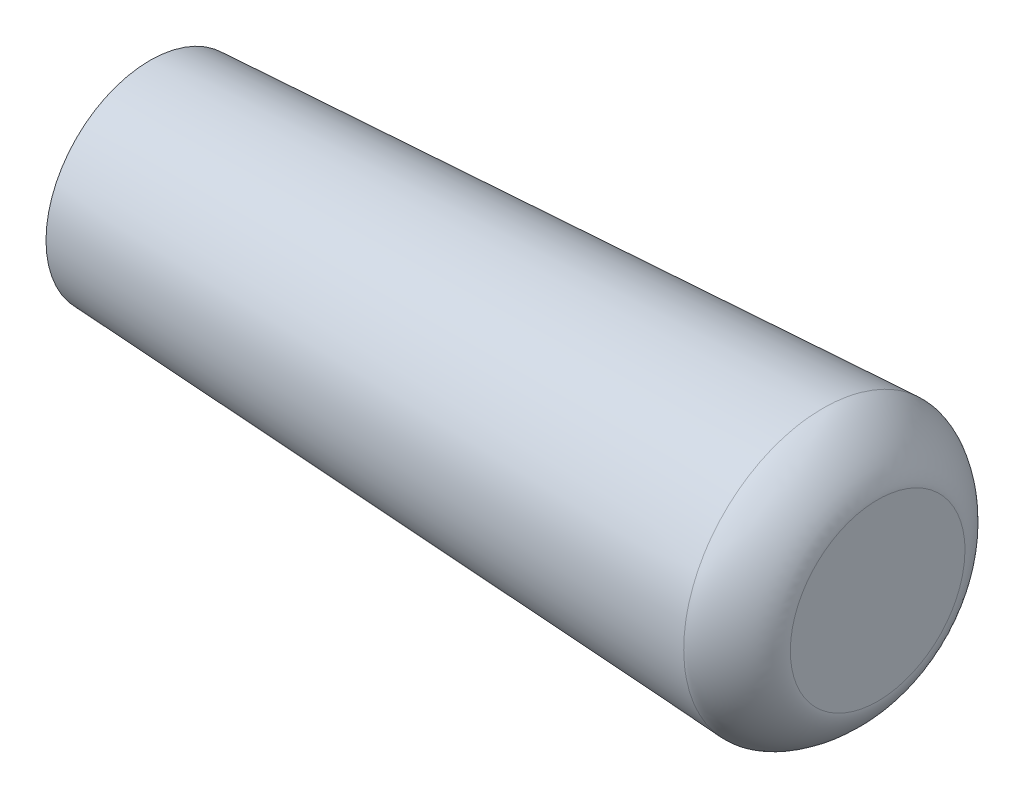
from build123d import *

# Parameters (mm, degrees)
SZKIC1_R                    = 10
DODANIE_WYCI_GNI_CIE1_DEPTH = 70
DODANIE_WYCI_GNI_CIE1_DRAFT = -3
SZKIC2_W                    = 9.53
SZKIC2_H                    = 15.06
WYTNIJ_WYCI_GNI_CIE1_DEPTH  = 60


with BuildPart() as part:
    # Szkic1 → Dodanie-wyciągnięcie1 (with draft: the straight prism first)
    with BuildSketch(Plane(origin=(0, 0, 0), x_dir=(0, 0, -1), z_dir=(1, 0, 0))):
        Circle(SZKIC1_R)
    extrude(amount=DODANIE_WYCI_GNI_CIE1_DEPTH)
    # Dodanie-wyciągnięcie1: the draft: its side faces are tilted about the plane it starts from
    dodanie_wyci_gni_cie1_sides = [part.faces().sort_by_distance(p)[0] for p in [
        (35, 0, 10),
    ]]
    draft(dodanie_wyci_gni_cie1_sides, Plane(origin=(0, 0, 0), x_dir=(0, 0, -1), z_dir=(1, 0, 0)), DODANIE_WYCI_GNI_CIE1_DRAFT)

    # Zaokrąglenie1
    # a fillet whose section is not a circle: 5 mm, written as the material it takes off along each edge
    with BuildSketch(Plane(origin=(70, 0, 0), x_dir=(0, 0, -1), z_dir=(0, -1, 0))) as zaokr_glenie1_piece_1:
        with BuildLine():
            Bezier((13.392791597, -5.261679781), (13.66854455, 0), (8.399643923, 0), weights=[1, 0.344177288, 1])
            Line((8.399643923, 0), (13.66854455, 0))
            Line((13.66854455, 0), (13.392791597, -5.261679781))
        make_face()
    revolve(axis=Axis((70, 0, 0), (1, 0, 0)), mode=Mode.SUBTRACT)

    # Szkic2 → Wytnij-wyciągnięcie1 (cut)
    with BuildSketch(Plane.ZY):
        Rectangle(SZKIC2_W, SZKIC2_H)
    extrude(amount=-WYTNIJ_WYCI_GNI_CIE1_DEPTH, mode=Mode.SUBTRACT)


solid = part.part
